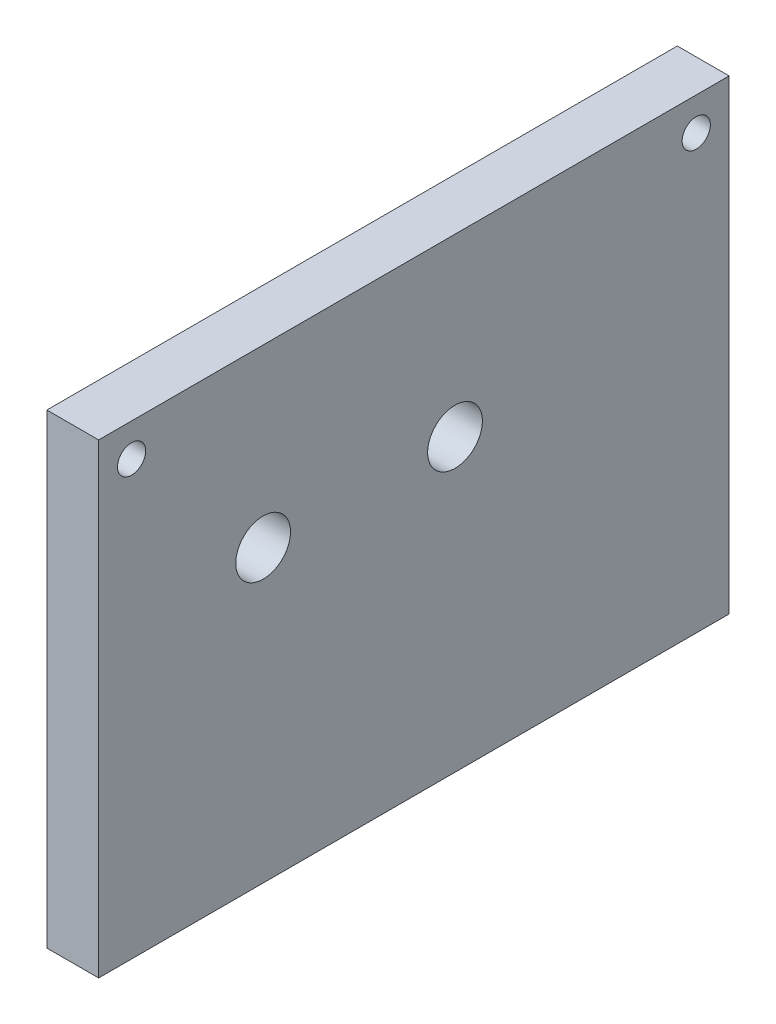
from build123d import *

# Parameters (mm, degrees)
SKETCH1_W                      = 146.05
SKETCH1_H                      = 107.95
SKETCH1_R                      = 6.34365
BOSS_EXTRUDE1_DEPTH            = 12
TAP_DRILL_FOR_10_32_TAP1_D     = 4.0386
TAP_DRILL_FOR_10_32_TAP1_DEPTH = 12.7
TAP_DRILL_FOR_10_32_TAP1_TIP   = 1.213317848
F_1_4_CLEARANCE_HOLE1_D        = 6.5278
F_1_4_CLEARANCE_HOLE1_DEPTH    = 12.7
F_1_4_CLEARANCE_HOLE1_TIP      = 1.961148974


with BuildPart() as part:
    # Sketch1 → Boss-Extrude1 (new body)
    with BuildSketch(Plane(origin=(0, 0, 0), x_dir=(0, 0, -1), z_dir=(1, 0, 0))):
        Rectangle(SKETCH1_W, SKETCH1_H)
        with Locations((-34.925, 13.335)):
            Circle(SKETCH1_R, mode=Mode.SUBTRACT)
        with Locations((9.525, 13.335)):
            Circle(SKETCH1_R, mode=Mode.SUBTRACT)
    extrude(amount=BOSS_EXTRUDE1_DEPTH)

    # Tap Drill for #10-32 Tap1
    with Locations(Plane(origin=(0, -53.975, 0), x_dir=(-1, 0, 0), z_dir=(0, -1, 0))):
        with Locations((-6, -60.325), (-6, 0), (-6, 60.325)):
            Hole(TAP_DRILL_FOR_10_32_TAP1_D / 2, depth=TAP_DRILL_FOR_10_32_TAP1_DEPTH)
            with Locations((0, 0, -(TAP_DRILL_FOR_10_32_TAP1_DEPTH + TAP_DRILL_FOR_10_32_TAP1_TIP / 2))):  # 118° drill point
                Cone(0, TAP_DRILL_FOR_10_32_TAP1_D / 2, TAP_DRILL_FOR_10_32_TAP1_TIP, mode=Mode.SUBTRACT)

    # 1/4 Clearance Hole1
    with Locations(Plane.ZY):
        with Locations((-65.405, 46.355), (65.405, 46.355)):
            Hole(F_1_4_CLEARANCE_HOLE1_D / 2, depth=F_1_4_CLEARANCE_HOLE1_DEPTH)
            with Locations((0, 0, -(F_1_4_CLEARANCE_HOLE1_DEPTH + F_1_4_CLEARANCE_HOLE1_TIP / 2))):  # 118° drill point
                Cone(0, F_1_4_CLEARANCE_HOLE1_D / 2, F_1_4_CLEARANCE_HOLE1_TIP, mode=Mode.SUBTRACT)


solid = part.part
